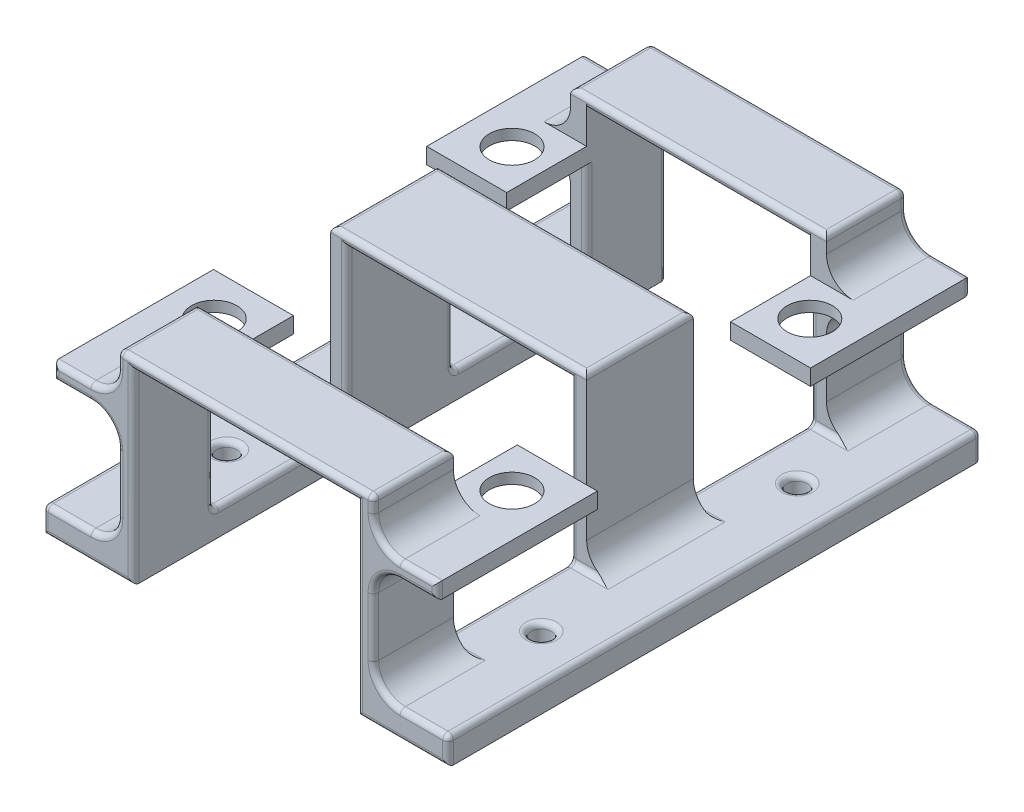
from build123d import *

# Parameters (mm, degrees)
SKETCH1_W                = 17
SKETCH1_H                = 100
SKETCH1_R                = 1.9
BOSS_EXTRUDE1_DEPTH      = 5
BOSS_EXTRUDE1_2_DEPTH    = 5
SKETCH2_W                = 3
SKETCH2_H                = 15
SKETCH2_H_2              = 20
BOSS_EXTRUDE2_DEPTH      = 30
SKETCH3_W                = 48
SKETCH3_H                = 15
SKETCH3_H_2              = 20
BOSS_EXTRUDE3_DEPTH      = 2
BOSS_EXTRUDE4_DEPTH      = 2
BOSS_EXTRUDE4_DEPTH_BACK = 1
SKETCH4_R                = 4.25
SKETCH5_R                = 6.5
CUT_EXTRUDE1_DEPTH       = 1
FILLET1_R                = 5
FILLET2_R                = 1


with BuildPart() as part:
    # Sketch1 → Boss-Extrude1 (new body)
    with BuildSketch(Plane(origin=(0, 0, 0), x_dir=(1, 0, 0), z_dir=(0, 1, 0))):
        with Locations((29.5, 0)):
            Rectangle(SKETCH1_W, SKETCH1_H)
        with Locations(Location((29.5, 24, 0), (0, 0, 90))):
            Circle(SKETCH1_R, mode=Mode.SUBTRACT)
        with Locations(Location((29.5, -24, 0), (0, 0, 270))):
            Circle(SKETCH1_R, mode=Mode.SUBTRACT)
    extrude(amount=BOSS_EXTRUDE1_DEPTH)



with BuildPart() as body_2:
    # Sketch1 → Boss-Extrude1 2 (new body)
    with BuildSketch(Plane(origin=(0, 0, 0), x_dir=(1, 0, 0), z_dir=(0, 1, 0))):
        with Locations((-29.5, 0)):
            Rectangle(SKETCH1_W, SKETCH1_H)
        with Locations(Location((-29.5, 24, 0), (0, 0, 270))):
            Circle(SKETCH1_R, mode=Mode.SUBTRACT)
        with Locations(Location((-29.5, -24, 0), (0, 0, 90))):
            Circle(SKETCH1_R, mode=Mode.SUBTRACT)
    extrude(amount=BOSS_EXTRUDE1_2_DEPTH)


with BuildPart() as part_1:
    add(part.part)

    add(body_2.part)  # Boss-Extrude2 merges body 2
    # Sketch2 → Boss-Extrude2 (add)
    with BuildSketch(Plane(origin=(0, 5, 0), x_dir=(1, 0, 0), z_dir=(0, 1, 0))):
        with Locations((-22.5, 42.5)):
            Rectangle(SKETCH2_W, SKETCH2_H)
        with Locations((-22.5, -42.5)):
            Rectangle(SKETCH2_W, SKETCH2_H)
        with Locations((-22.5, 0)):
            Rectangle(SKETCH2_W, SKETCH2_H_2)
        with Locations((22.5, -42.5)):
            Rectangle(SKETCH2_W, SKETCH2_H)
        with Locations((22.5, 0)):
            Rectangle(SKETCH2_W, SKETCH2_H_2)
        with Locations((22.5, 42.5)):
            Rectangle(SKETCH2_W, SKETCH2_H)
    extrude(amount=BOSS_EXTRUDE2_DEPTH)

    # Sketch3 → Boss-Extrude3 (add)
    with BuildSketch(Plane(origin=(0, 35, 0), x_dir=(1, 0, 0), z_dir=(0, 1, 0))):
        with Locations((0, 42.5)):
            Rectangle(SKETCH3_W, SKETCH3_H)
        Rectangle(SKETCH3_W, SKETCH3_H_2)
        with Locations((0, -42.5)):
            Rectangle(SKETCH3_W, SKETCH3_H)
    extrude(amount=BOSS_EXTRUDE3_DEPTH)

    # Sketch4 → Boss-Extrude4 (add, two sides: drawn at the far end of the back side and taken through both)
    # profile 1 of 4: a face of its own
    with BuildSketch(Plane(origin=(0, 27, 0), x_dir=(1, 0, 0), z_dir=(0, 1, 0)).offset(-BOSS_EXTRUDE4_DEPTH_BACK)):
        Polygon((-24, -50), (-36, -50), (-36, -20), (-26, -20), (-21, -20), (-21, -35), (-24, -35), align=None)
        with Locations(Location((-27.930717857, -27.930717857, 0), (0, 0, 270))):
            Circle(SKETCH4_R, mode=Mode.SUBTRACT)
    # profile 2 of 4: a face of its own
    with BuildSketch(Plane(origin=(0, 27, 0), x_dir=(1, 0, 0), z_dir=(0, 1, 0)).offset(-BOSS_EXTRUDE4_DEPTH_BACK)):
        Polygon((-26, 20), (-36, 20), (-36, 50), (-24, 50), (-24, 35), (-21, 35), (-21, 20), align=None)
        with Locations(Location((-27.930717857, 27.930717857, 0), (0, 0, 90))):
            Circle(SKETCH4_R, mode=Mode.SUBTRACT)
    # profile 3 of 4: a face of its own
    with BuildSketch(Plane(origin=(0, 27, 0), x_dir=(1, 0, 0), z_dir=(0, 1, 0)).offset(-BOSS_EXTRUDE4_DEPTH_BACK)):
        Polygon((26, -20), (36, -20), (36, -50), (24, -50), (24, -35), (21, -35), (21, -20), align=None)
        with Locations(Location((27.930717857, -27.930717857, 0), (0, 0, 90))):
            Circle(SKETCH4_R, mode=Mode.SUBTRACT)
    # profile 4 of 4: a face of its own
    with BuildSketch(Plane(origin=(0, 27, 0), x_dir=(1, 0, 0), z_dir=(0, 1, 0)).offset(-BOSS_EXTRUDE4_DEPTH_BACK)):
        Polygon((26, 20), (21, 20), (21, 35), (24, 35), (24, 50), (36, 50), (36, 20), align=None)
        with Locations(Location((27.930717857, 27.930717857, 0), (0, 0, 270))):
            Circle(SKETCH4_R, mode=Mode.SUBTRACT)
    extrude(amount=BOSS_EXTRUDE4_DEPTH + BOSS_EXTRUDE4_DEPTH_BACK)

    # Sketch5 → Cut-Extrude1 (cut)
    with BuildSketch(Plane.XZ.offset(-26)):
        with Locations(Location((-27.930717857, -27.930717857, 0), (0, 0, 270))):
            Circle(SKETCH5_R)
        with Locations(Location((-27.930717857, 27.930717857, 0), (0, 0, 270))):
            Circle(SKETCH5_R)
        with Locations(Location((27.930717857, 27.930717857, 0), (0, 0, 270))):
            Circle(SKETCH5_R)
        with Locations(Location((27.930717857, -27.930717857, 0), (0, 0, 270))):
            Circle(SKETCH5_R)
    extrude(amount=-CUT_EXTRUDE1_DEPTH, mode=Mode.SUBTRACT)

    # Fillet1
    fillet1_edges = [part_1.edges().sort_by_distance(p)[0] for p in [
        (-24, 26, 42.5),
        (-24, 29, 42.5),
        (-24, 26, -42.5),
        (-24, 29, -42.5),
        (24, 26, 42.5),
        (24, 29, 42.5),
        (24, 26, -42.5),
        (24, 29, -42.5),
        (-24, 5, -42.5),
        (-24, 5, 42.5),
        (-24, 5, 0),
        (24, 5, 42.5),
        (24, 5, 0),
        (24, 5, -42.5),
    ]]
    fillet(fillet1_edges, radius=FILLET1_R)

    # Fillet2
    fillet2_edges = [part_1.edges().sort_by_distance(p)[0] for p in [
        (-25, 5, -35),
        (-25, 5, 35),
        (-25, 5, 10),
        (-25, 5, -10),
        (25, 5, 35),
        (25, 5, -10),
        (25, 5, 10),
        (25, 5, -35),
    ]]
    fillet(fillet2_edges, radius=FILLET2_R)
    fillet2_2_edges = [part_1.edges().sort_by_distance(p)[0] for p in [
        (-38, 5, 0),
        (0, 37, -10),
        (0, 35, 50),
        (0, 35, 35),
        (-24, 37, 42.5),
        (0, 37, 50),
        (24, 37, 42.5),
        (0, 37, 35),
        (-29.5, 5, -25.9),
        (-33.5, 5, 50),
        (-32.5, 26, 50),
        (-36, 27.5, 50),
        (-32.5, 29, 50),
        (-36, 27.5, -50),
        (-29.5, 5, 25.9),
        (36, 27.5, 50),
        (32.5, 26, -50),
        (36, 27.5, -50),
        (32.5, 29, -50),
        (-24, 35.5, -50),
        (-24, 15.5, 50),
        (-33.5, 5, -50),
        (-24, 15.5, -50),
        (33.5, 5, 50),
        (24, 15.5, -50),
        (24, 15.5, 50),
        (-32.5, 26, -50),
        (-32.5, 29, -50),
        (32.5, 29, 50),
        (32.5, 26, 50),
        (-25.464466094, 6.464466094, 50),
        (-25.464466094, 6.464466094, -50),
        (25.464466094, 6.464466094, -50),
        (25.464466094, 6.464466094, 50),
        (-25.464466094, 24.535533906, 50),
        (-25.464466094, 30.464466094, 50),
        (-25.464466094, 24.535533906, -50),
        (-25.464466094, 30.464466094, -50),
        (25.464466094, 30.464466094, -50),
        (25.464466094, 30.464466094, 50),
        (25.464466094, 24.535533906, 50),
        (25.464466094, 24.535533906, -50),
        (-24, 35.5, 50),
        (-29.5, 0, 50),
        (-29.5, 0, -50),
        (0, 35, -35),
        (24, 35.5, -50),
        (-24, 37, -42.5),
        (0, 37, -35),
        (24, 37, -42.5),
        (0, 37, -50),
        (0, 35, -50),
        (38, 5, 0),
        (33.5, 5, -50),
        (38, 2.5, 50),
        (29.5, 0, -50),
        (38, 2.5, -50),
        (21, 17.5, -50),
        (29.5, 0, 50),
        (21, 17.5, 50),
        (29.5, 5, -22.1),
        (29.5, 5, 22.1),
        (24, 35.5, 50),
        (-21, 17.5, 50),
        (-38, 2.5, 50),
        (-38, 2.5, -50),
        (-21, 17.5, -50),
        (0, 35, 10),
        (0, 35, -10),
        (-24, 37, 0),
        (0, 37, 10),
        (24, 37, 0),
    ]]
    fillet(fillet2_2_edges, radius=FILLET2_R - 0.0001)  # a hair under: the kernel refuses the full size
    fillet2_3_edges = [part_1.edges().sort_by_distance(p)[0] for p in [
        (-21, 5, 22.5),
        (-21, 5, -22.5),
        (-21, 20.5, 10),
        (-21, 20.5, -10),
        (21, 5, -22.5),
        (21, 5, 22.5),
        (21, 20.5, -10),
        (21, 20.5, 10),
        (21, 5.292893219, 10.292893219),
        (21, 35.49995, 10),
        (21, 5.292893219, -10.292893219),
        (21, 35.49995, -10),
        (21, 5.292893219, 34.707106781),
        (21, 5.292893219, -34.707106781),
        (-21, 5.292893219, -10.292893219),
        (-21, 35.49995, -10),
        (-21, 5.292893219, 10.292893219),
        (-21, 35.49995, 10),
        (-21, 5.292893219, -34.707106781),
        (-21, 5.292893219, 34.707106781),
    ]]
    fillet(fillet2_3_edges, radius=FILLET2_R - 0.0001)  # a hair under: the kernel refuses the full size


solid = part_1.part
